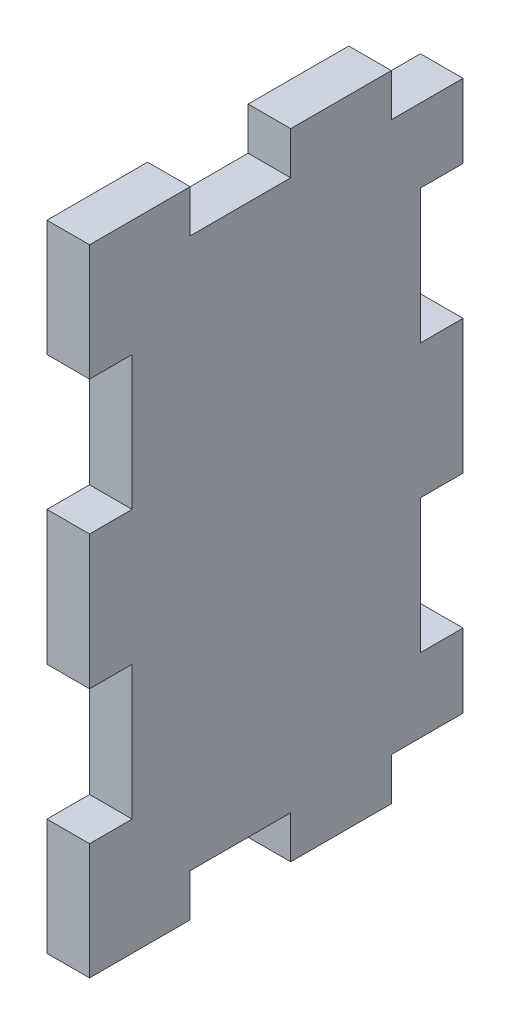
from build123d import *

# Parameters (mm, degrees)
SKETCH1_W           = 35.35
SKETCH1_H           = 47.35
BOSS_EXTRUDE1_DEPTH = 3.175
SKETCH2_W           = 7.5
SKETCH2_H           = 47.35
CUT_EXTRUDE1_DEPTH  = 60.175380227
SKETCH3_W           = 3.175
SKETCH3_H           = 10
SKETCH3_W_2         = 7.5
SKETCH3_H_2         = 3.175
SKETCH3_W_3         = 5.35
CUT_EXTRUDE2_DEPTH  = 56.02477283


with BuildPart() as part:
    # Sketch1 → Boss-Extrude1 (new body)
    with BuildSketch(Plane(origin=(0, 0, 0), x_dir=(0, 0, -1), z_dir=(1, 0, 0))):
        with Locations((17.675, 23.675)):
            Rectangle(SKETCH1_W, SKETCH1_H)
    extrude(amount=BOSS_EXTRUDE1_DEPTH)

    # Sketch2 → Cut-Extrude1 (cut, through all)
    with BuildSketch(Plane.ZY):
        with Locations((-31.6, 23.675)):
            Rectangle(SKETCH2_W, SKETCH2_H)
    extrude(amount=-CUT_EXTRUDE1_DEPTH, mode=Mode.SUBTRACT)

    # Sketch3 → Cut-Extrude2 (cut, through all)
    with BuildSketch(Plane.ZY):
        with Locations((-1.5875, 13.675)):
            Rectangle(SKETCH3_W, SKETCH3_H)
        with Locations((-1.5875, 33.675)):
            Rectangle(SKETCH3_W, SKETCH3_H)
        with Locations((-26.2625, 13.675)):
            Rectangle(SKETCH3_W, SKETCH3_H)
        with Locations((-26.2625, 33.675)):
            Rectangle(SKETCH3_W, SKETCH3_H)
        with Locations((-11.25, 45.7625)):
            Rectangle(SKETCH3_W_2, SKETCH3_H_2)
        with Locations((-11.25, 1.5875)):
            Rectangle(SKETCH3_W_2, SKETCH3_H_2)
        with Locations((-25.175, 45.7625)):
            Rectangle(SKETCH3_W_3, SKETCH3_H_2)
        with Locations((-25.175, 1.5875)):
            Rectangle(SKETCH3_W_3, SKETCH3_H_2)
    extrude(amount=-CUT_EXTRUDE2_DEPTH, mode=Mode.SUBTRACT)


solid = part.part
